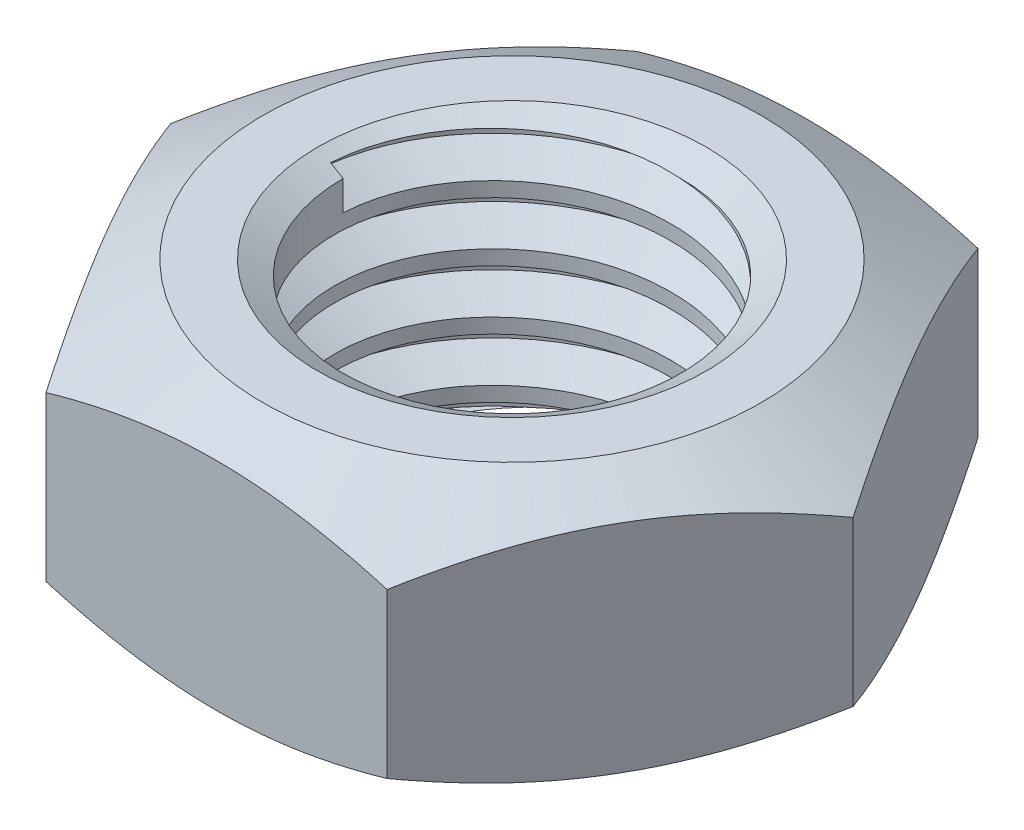
from build123d import *

# Parameters (mm, degrees)
SALIENTE_EXTRUIR1_DEPTH    = 1.6
CORTAR_EXTRUIR1_DEPTH      = 6.580621232
CORTAR_EXTRUIR1_DEPTH_BACK = 6.580621232
CROQUIS2_R                 = 2
ROSCA1_PITCH               = 0.7


with BuildPart() as part:
    # Croquis1 → Saliente-Extruir1 (new, symmetric)
    with BuildSketch(Plane(origin=(0, 0, 0), x_dir=(1, 0, 0), z_dir=(0, 1, 0))):
        Polygon((4.041451884, 0), (2.020725942, 3.5), (-2.020725942, 3.5), (-4.041451884, 0), (-2.020725942, -3.5), (2.020725942, -3.5), align=None)
    extrude(amount=SALIENTE_EXTRUIR1_DEPTH, both=True)

    # Croquis2 → Cortar-Extruir1 (cut, two sides: drawn at the far end of the back side and taken through both)
    with BuildSketch(Plane(origin=(0, 0, 0), x_dir=(1, 0, 0), z_dir=(0, 1, 0)).offset(-CORTAR_EXTRUIR1_DEPTH_BACK)):
        with Locations(Location((0, 0, 0), (0, 0, 270))):
            Circle(CROQUIS2_R)
    extrude(amount=CORTAR_EXTRUIR1_DEPTH + CORTAR_EXTRUIR1_DEPTH_BACK, mode=Mode.SUBTRACT)

    # Rosca1: the profile of Perfil de rosca1 profile screwed along a right-hand helix of 4.571429 turns, 6 arcs to a turn; built about Z, then put on its axis
    rosca1_z = Axis((0, 0, 0), (0, 0, 1))
    rosca1_corners = [(1.9997, 0, -0.000173205), (2.378886113, 0, 0.218749999), (2.378886113, 0, 0.306249999), (1.9997, 0, 0.525173203)]
    with BuildLine(mode=Mode.PRIVATE) as rosca1_profile:
        Line(rosca1_corners[0], rosca1_corners[1])
        Line(rosca1_corners[1], rosca1_corners[2])
        Line(rosca1_corners[2], rosca1_corners[3])
        Line(rosca1_corners[3], rosca1_corners[0])
    rosca1_cap = Face(rosca1_profile.wire())
    rosca1_turn_angles = [0, 30, 60, 90, 120, 150, 180, 210, 240, 270, 300, 330, 360]
    rosca1_turn_weights = [1, 0.8660254037844387, 1, 0.8660254037844387, 1, 0.8660254037844387, 1, 0.8660254037844387, 1, 0.8660254037844387, 1, 0.8660254037844387, 1]
    rosca1_turn_rails = [Edge.make_bspline([Vector(p[0], p[1], 0).rotate(rosca1_z, rosca1_turn_angles[k]) / rosca1_turn_weights[k] + Vector(0, 0, p[2] + ROSCA1_PITCH * rosca1_turn_angles[k] / 360) for k in range(13)], [0, 0, 0, 1, 1, 2, 2, 3, 3, 4, 4, 5, 5, 6, 6, 6], 2, rosca1_turn_weights) for p in rosca1_corners]
    rosca1_turn_sides = [Face.make_surface_from_curves(rosca1_turn_rails[p[0]], rosca1_turn_rails[p[1]]) for p in [(0, 1), (1, 2), (2, 3), (3, 0)]]
    rosca1_last_angles = [1440, 1470, 1500, 1530, 1560, 1590, 1620, 1632.857142857, 1645.714285714]
    rosca1_last_weights = [1, 0.8660254037844387, 1, 0.8660254037844387, 1, 0.8660254037844387, 1, 0.9749279121818235, 1]
    rosca1_last_rails = [Edge.make_bspline([Vector(p[0], p[1], 0).rotate(rosca1_z, rosca1_last_angles[k]) / rosca1_last_weights[k] + Vector(0, 0, p[2] + ROSCA1_PITCH * rosca1_last_angles[k] / 360) for k in range(9)], [0, 0, 0, 1, 1, 2, 2, 3, 3, 4, 4, 4], 2, rosca1_last_weights) for p in rosca1_corners]
    rosca1_last_sides = [Face.make_surface_from_curves(rosca1_last_rails[p[0]], rosca1_last_rails[p[1]]) for p in [(0, 1), (1, 2), (2, 3), (3, 0)]]
    rosca1 = Plane(origin=(0, 1.6, 0), x_dir=(-1, 0, 0), z_dir=(0, -1, 0)) * Solid(Shell([*[p.moved(Location((0, 0, ROSCA1_PITCH * i))) for i in range(4) for p in rosca1_turn_sides], *rosca1_last_sides, rosca1_cap, rosca1_cap.rotate(rosca1_z, 1645.714285714).moved(Location((0, 0, ROSCA1_PITCH * 1645.714285714 / 360)))]))
    add(rosca1, mode=Mode.SUBTRACT)

    # Croquis6 → Cortar-Revolución1 (revolve, cut)
    with BuildSketch(Plane.XY, mode=Mode.PRIVATE) as cortar_revoluci_n1_sk:
        with BuildLine():
            Line((2.95, 1.6), (4.041451884, 0.969849961))
            add(Edge.make_bspline(
                [(2.95, 1.6), (4.466822083, 6.836766984), (8.411490239, -0.350327631), (4.041451884, 0.969849961)],
                knots=[0, 0, 0, 0, 1, 1, 1, 1], degree=3))
        make_face()
        with BuildLine():
            Line((2, 1.426794919), (2.3, 1.6))
            add(Edge.make_bspline(
                [(2, 1.426794919), (-2.611470244, 2.201825506), (3.253596338, 4.32682816), (2.3, 1.6)],
                knots=[0, 0, 0, 0, 1, 1, 1, 1], degree=3))
        make_face()
    cortar_revoluci_n1 = revolve(cortar_revoluci_n1_sk.sketch.rotate(Axis((0, -1.6, 0), (0, 1, 0)), 180), axis=Axis((0, -1.6, 0), (0, 1, 0)), mode=Mode.SUBTRACT)

    # Simetría1: Cortar-Revolución1 across plane
    add(cortar_revoluci_n1.mirror(Plane.ZX), mode=Mode.SUBTRACT)


solid = part.part
